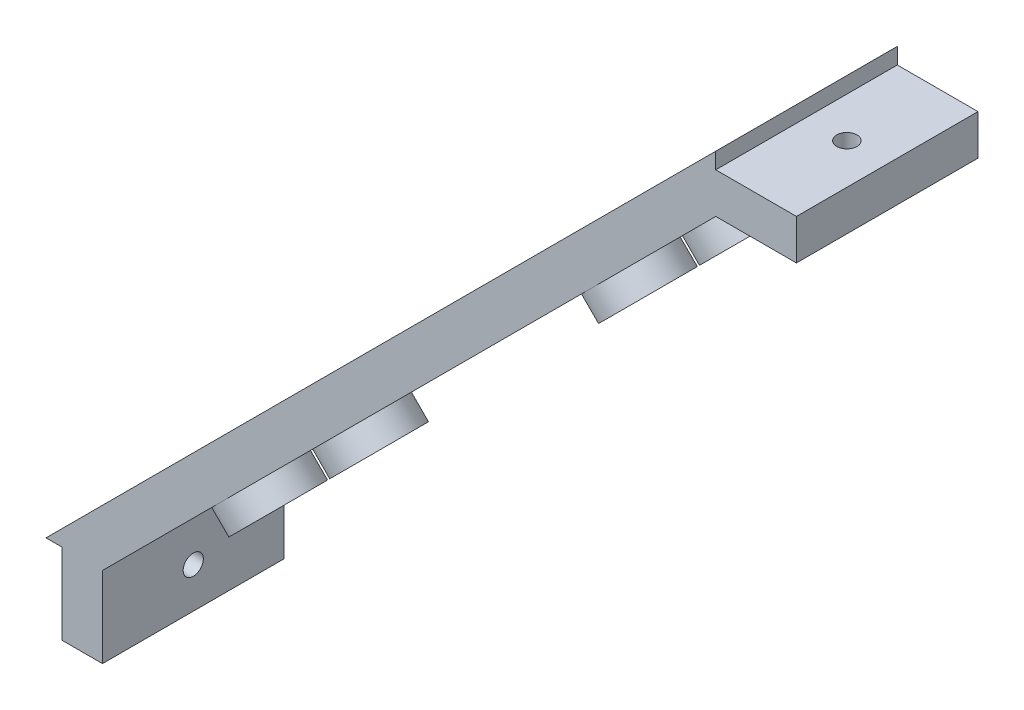
from build123d import *

# Parameters (mm, degrees)
MAIN_DEPTH                = 11.25
SKETCH2_R                 = 1.25
FIXHOLE1_DEPTH            = 99.325034961
SKETCH3_R                 = 1.25
FIXHOLE2_DEPTH            = 99.325034961
SKETCH6_R                 = 1.25
CUT_EXTRUDE2_DEPTH        = 69.80815722
LPATTERN1_COUNT           = 5
LPATTERN1_PITCH           = 20
SKETCH7_R                 = 5
BOSS_EXTRUDE1_DEPTH       = 3
SKETCH8_R                 = 1.25
CUT_EXTRUDE3_DEPTH        = 68.582543322
LPATTERN2_COUNT           = 2
LPATTERN2_PITCH           = 12.5
LPATTERN2_COPY_1_SKETCH_R = 1.25
LPATTERN2_COPY_1_DEPTH    = 69.80815722
LPATTERN2_COPY_2_SKETCH_R = 1.25
LPATTERN2_COPY_2_DEPTH    = 69.80815722
LPATTERN2_COPY_3_SKETCH_R = 1.25
LPATTERN2_COPY_3_DEPTH    = 69.80815722
LPATTERN2_COPY_4_SKETCH_R = 1.25
LPATTERN2_COPY_4_DEPTH    = 69.80815722
LPATTERN2_COPY_5_SKETCH_R = 1.25
LPATTERN2_COPY_5_DEPTH    = 69.80815722


with BuildPart() as part:
    # Sketch1 → Main (new, symmetric)
    with BuildSketch(Plane.XY):
        Polygon((-41.5, -41.5), (41.5, 41.5), (41.5, 39.5), (51.5, 39.5), (51.5, 34.5), (41.5, 34.5), (-34.5, -41.5), (-34.5, -51.5), (-39.5, -51.5), (-39.5, -41.5), align=None)
    extrude(amount=MAIN_DEPTH, both=True)

    # Sketch2 → FixHole1 (cut, through all)
    with BuildSketch(Plane(origin=(41.5, 0, 0), x_dir=(0, 0, -1), z_dir=(1, 0, 0))):
        with Locations((0, -46.5)):
            Circle(SKETCH2_R)
    extrude(amount=-FIXHOLE1_DEPTH, mode=Mode.SUBTRACT)

    # Sketch3 → FixHole2 (cut, through all)
    with BuildSketch(Plane(origin=(0, -41.5, 0), x_dir=(-1, 0, 0), z_dir=(0, -1, 0))):
        with Locations((-46.5, 0)):
            Circle(SKETCH3_R)
    extrude(amount=-FIXHOLE2_DEPTH, mode=Mode.SUBTRACT)

    # Sketch6 → Cut-Extrude2 (cut, through all)
    with BuildSketch(Plane(origin=(3.5, -3.5, 0), x_dir=(0, 0, 1), z_dir=(-0.7071067811865489, 0.7071067811865461, 0))):
        with Locations((-6.25, 40)):
            Circle(SKETCH6_R)
    cut_extrude2 = extrude(amount=CUT_EXTRUDE2_DEPTH, mode=Mode.SUBTRACT)

    # LPattern1: Cut-Extrude2 ×5
    with Locations(*[Vector(-0.7071067811865461, -0.7071067811865489, 0) * (i * LPATTERN1_PITCH) for i in range(1, LPATTERN1_COUNT)]):
        add(cut_extrude2, mode=Mode.SUBTRACT)

    # Sketch7 → Boss-Extrude1 (add)
    with BuildSketch(Plane(origin=(3.5, -3.5, 0), x_dir=(0, 0, 1), z_dir=(-0.7071067811865488, 0.7071067811865464, 0))):
        with Locations((-6.25, -33.008531019)):
            Circle(SKETCH7_R)
        with Locations((-6.25, 31.791468981)):
            Circle(SKETCH7_R)
    boss_extrude1 = extrude(amount=-BOSS_EXTRUDE1_DEPTH)

    # Sketch8 → Cut-Extrude3 (cut, through all)
    with BuildSketch(Plane(origin=(5.621320344, -5.621320344, 0), x_dir=(0, 0, -1), z_dir=(0.7071067811865488, -0.7071067811865464, 0))):
        with Locations((6.25, 31.791468981)):
            Circle(SKETCH8_R)
        with Locations((6.25, -33.008531019)):
            Circle(SKETCH8_R)
    cut_extrude3 = extrude(amount=-CUT_EXTRUDE3_DEPTH, mode=Mode.SUBTRACT)

    # LPattern2: Boss-Extrude1, Cut-Extrude3 ×2
    with Locations(*[(0, 0, i * LPATTERN2_PITCH) for i in range(1, LPATTERN2_COUNT)]):
        add(boss_extrude1)
        add(cut_extrude3, mode=Mode.SUBTRACT)

    # LPattern2 copy 1 sketch → LPattern2 copy 1 (cut, through all)
    with BuildSketch(Plane(origin=(-10.642135624, -17.642135624, 12.5), x_dir=(0, 0, 1), z_dir=(-0.7071067811865489, 0.7071067811865461, 0))):
        with Locations((-6.25, 40)):
            Circle(LPATTERN2_COPY_1_SKETCH_R)
    extrude(amount=LPATTERN2_COPY_1_DEPTH, mode=Mode.SUBTRACT)

    # LPattern2 copy 2 sketch → LPattern2 copy 2 (cut, through all)
    with BuildSketch(Plane(origin=(-24.784271247, -31.784271247, 12.5), x_dir=(0, 0, 1), z_dir=(-0.7071067811865489, 0.7071067811865461, 0))):
        with Locations((-6.25, 40)):
            Circle(LPATTERN2_COPY_2_SKETCH_R)
    extrude(amount=LPATTERN2_COPY_2_DEPTH, mode=Mode.SUBTRACT)

    # LPattern2 copy 3 sketch → LPattern2 copy 3 (cut, through all)
    with BuildSketch(Plane(origin=(-38.926406871, -45.926406871, 12.5), x_dir=(0, 0, 1), z_dir=(-0.7071067811865489, 0.7071067811865461, 0))):
        with Locations((-6.25, 40)):
            Circle(LPATTERN2_COPY_3_SKETCH_R)
    extrude(amount=LPATTERN2_COPY_3_DEPTH, mode=Mode.SUBTRACT)

    # LPattern2 copy 4 sketch → LPattern2 copy 4 (cut, through all)
    with BuildSketch(Plane(origin=(-53.068542495, -60.068542495, 12.5), x_dir=(0, 0, 1), z_dir=(-0.7071067811865489, 0.7071067811865461, 0))):
        with Locations((-6.25, 40)):
            Circle(LPATTERN2_COPY_4_SKETCH_R)
    extrude(amount=LPATTERN2_COPY_4_DEPTH, mode=Mode.SUBTRACT)

    # LPattern2 copy 5 sketch → LPattern2 copy 5 (cut, through all)
    with BuildSketch(Plane(origin=(3.5, -3.5, 12.5), x_dir=(0, 0, 1), z_dir=(-0.7071067811865489, 0.7071067811865461, 0))):
        with Locations((-6.25, 40)):
            Circle(LPATTERN2_COPY_5_SKETCH_R)
    extrude(amount=LPATTERN2_COPY_5_DEPTH, mode=Mode.SUBTRACT)


solid = part.part
